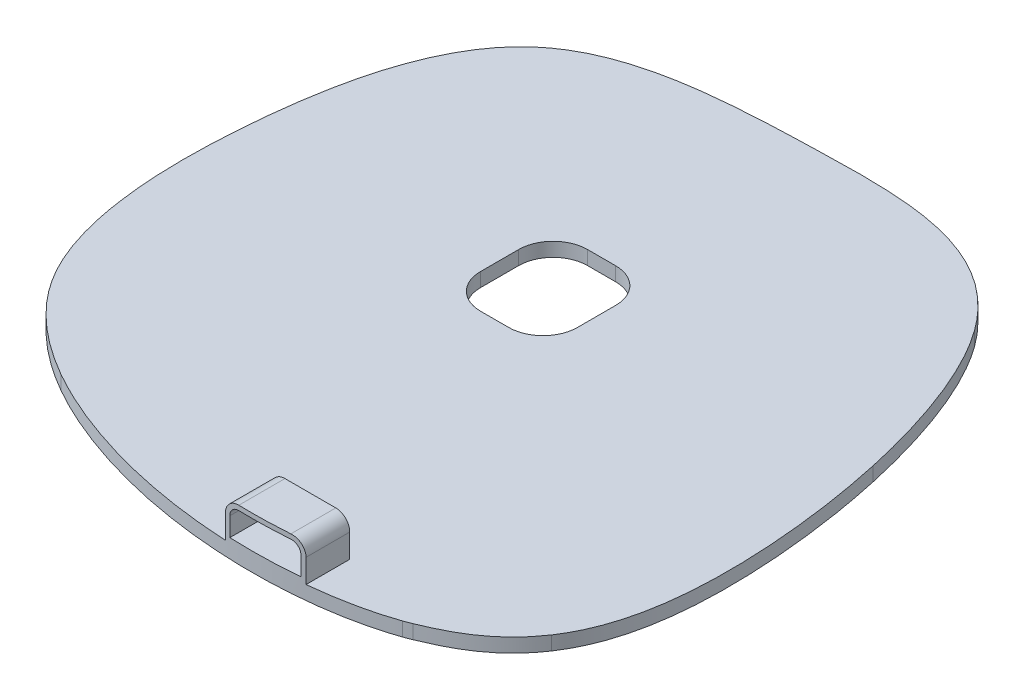
from build123d import *
from OCP.BRepAlgoAPI import BRepAlgoAPI_Cut
from OCP.TopTools import TopTools_ListOfShape

# Parameters (mm, degrees)
BOSS_EXTRUDE1_DEPTH     = 3
CUT_EXTRUDE1_DEPTH      = 144.23767893
CUT_EXTRUDE1_DEPTH_BACK = 144.23767893
BOSS_EXTRUDE3_START     = 10
BOSS_EXTRUDE3_DEPTH     = 9.956318054
BOSS_EXTRUDE3_START_2   = -8.187017634
BOSS_EXTRUDE3_2_DEPTH   = 9.187017634


with BuildPart() as part:
    # Sketch3 → Boss-Extrude1 (new body)
    with BuildSketch(Plane.XZ.offset(8.187017634)):
        with BuildLine():
            add(Edge.make_bspline(
                [(-43.682566816, -9.809144312), (-43.590850956, -9.669201086), (-43.396610236, -9.372821886), (-43.080896899, -8.908734706), (-42.724393103, -8.400321885), (-42.32400403, -7.849195802), (-41.615293388, -6.908817047), (-40.808804908, -5.913212767), (-39.421316231, -4.319477259), (-37.76057815, -2.587225531), (-35.792161476, -0.778420463), (-34.111819694, 0.631689986), (-32.693848258, 1.745924093), (-31.251435295, 2.810065063), (-29.788918148, 3.825847458), (-28.309782938, 4.793892733), (-26.819630528, 5.718932105), (-25.812202881, 6.30280495), (-25.310659617, 6.593483385)],
                knots=[0, 0, 0, 0, 0.020191439, 0.042762503, 0.067732139, 0.095123596, 0.124964849, 0.209829091, 0.249662232, 0.379957752, 0.499149862, 0.572092554, 0.644633713, 0.716739963, 0.788372792, 0.859490184, 0.930047828, 1, 1, 1, 1], degree=3))
            add(Edge.make_bspline(
                [(-25.310659617, 6.593483385), (-24.970200363, 6.785793855), (-24.280182246, 7.175554764), (-23.220093945, 7.747533568), (-22.12405835, 8.319167417), (-20.990827613, 8.888158763), (-19.820305217, 9.454140313), (-18.189743738, 10.212695389), (-16.502634346, 10.951826298), (-13.577439707, 12.158400035), (-9.444540771, 13.700220079), (-3.555445749, 15.541221152), (2.278739642, 17.006312941), (8.004123853, 18.146930639), (13.402502776, 18.977806488), (20.675142188, 19.749806445), (29.639972518, 20.117081214), (38.263934767, 19.682989741), (44.798325753, 18.85040122), (48.403246041, 18.209053366), (50.781276858, 17.683644778), (52.16838647, 17.346896245), (53.438020845, 17.018093105), (54.878425382, 16.608660829), (56.244093222, 16.182108454), (57.030439158, 15.911224408), (57.366403469, 15.795489885)],
                knots=[0, 0, 0, 0, 0.013751042, 0.027869615, 0.042359051, 0.057222443, 0.072462572, 0.088081834, 0.120464948, 0.137230934, 0.199359689, 0.275519761, 0.354105918, 0.410781923, 0.480777502, 0.546109171, 0.667907428, 0.79592754, 0.84921164, 0.899494417, 0.92463146, 0.93484759, 0.949692056, 0.970752009, 0.98750387, 1, 1, 1, 1], degree=3))
            add(Edge.make_bspline(
                [(57.366403469, 15.795489885), (57.919521789, 15.601207307), (58.449218921, 15.397557399), (58.991043235, 15.172433481)],
                knots=[-0.176019581, -0.176019581, -0.176019581, -0.176019581, 0, 0, 0, 0], degree=3, weights=[1, 1, 1, 1]))
            add(Edge.make_bspline(
                [(58.991043235, 15.172433481), (59.634186233, 14.900681635), (60.900085641, 14.365792036), (62.725726454, 13.520013652), (64.458799852, 12.645249568), (66.810958903, 11.307685619), (69.534038895, 9.44170771), (72.297914712, 6.965561641), (74.392789476, 4.635992549), (75.489070594, 3.080204878), (75.985982473, 2.375012239)],
                knots=[0, 0, 0, 0, 0.096909833, 0.190747782, 0.27923455, 0.366292326, 0.566253189, 0.735974001, 0.880324806, 1, 1, 1, 1], degree=3))
            add(Edge.make_bspline(
                [(75.985982473, 2.375012239), (76.088015858, 2.220624418), (76.294048091, 1.908874812), (76.595298016, 1.429668488), (76.894212142, 0.936012093), (77.189730191, 0.426951878), (77.58321526, -0.28003934), (78.065377712, -1.205741604), (78.620675828, -2.374033471), (79.156084112, -3.614870737), (79.669149921, -4.932396369), (80.071056325, -6.083754953), (80.46119802, -7.301576492), (80.758320385, -8.31998231), (81.036788019, -9.371049159), (81.240017196, -10.192874343), (81.434715144, -11.039190011), (81.878857858, -13.122405334), (82.404381966, -16.338232988), (82.82455413, -20.51848832), (83.025188464, -24.19433304), (83.092428842, -27.302921809), (83.086797443, -30.027635006), (83.030841686, -32.595470269), (82.926060916, -35.1954941), (82.77429239, -37.818991711), (82.577350997, -40.457703759), (82.337016037, -43.103819594), (82.055037768, -45.749965785), (81.733129079, -48.38919365), (81.372996817, -51.014974842), (80.976230154, -53.621165553), (80.544717041, -56.202087277), (80.079111937, -58.752177434), (79.584473973, -61.267223057), (79.225342853, -62.927362848), (79.04695737, -63.751977655)],
                knots=[0, 0, 0, 0, 0.008202511, 0.016563026, 0.025087347, 0.033781584, 0.042652161, 0.060949615, 0.080037457, 0.099978579, 0.120841024, 0.142697979, 0.154023665, 0.177520757, 0.189713624, 0.20221753, 0.215043977, 0.228204775, 0.296629414, 0.359325815, 0.414352076, 0.459761624, 0.497130193, 0.535117705, 0.573601518, 0.61246416, 0.651593538, 0.690883057, 0.730231678, 0.769543936, 0.808729915, 0.847705209, 0.886390848, 0.924713224, 0.962603998, 1, 1, 1, 1], degree=3))
            add(Edge.make_bspline(
                [(79.04695737, -63.751977655), (78.951356262, -64.18016083), (78.76069578, -65.034100832), (78.46273267, -66.308282168), (78.157125506, -67.572429364), (77.843107847, -68.825759318), (77.521060237, -70.067757704), (77.082800559, -71.701393), (76.627476175, -73.31633203), (76.039280361, -75.301311065), (75.554141141, -76.86146511), (75.051994106, -78.399614249), (74.670239624, -79.532229636), (74.28163008, -80.649060636), (73.886297687, -81.749685133), (73.484373815, -82.833694777), (73.075988984, -83.90069485), (72.661272846, -84.950304117), (72.240354178, -85.982154696), (71.813360869, -86.995891912), (71.380419903, -87.991174161), (70.941657358, -88.967672769), (70.497198382, -89.925071851), (70.047167197, -90.86306818), (69.591687064, -91.781371028), (69.130880342, -92.679702077), (68.664868233, -93.557795105), (68.193771658, -94.415396488), (67.717708014, -95.25226271), (67.236802953, -96.068168778), (66.751147438, -96.862876947), (66.260953983, -97.63624986), (65.765988259, -98.387838319), (65.267635916, -99.118379651), (64.927127521, -99.593225407), (64.758385477, -99.828539558)],
                knots=[0, 0, 0, 0, 0.033703637, 0.067216289, 0.100524355, 0.133614665, 0.166474475, 0.199091472, 0.263549931, 0.295368927, 0.358133543, 0.389059312, 0.419668221, 0.44995145, 0.479900623, 0.509507815, 0.538765558, 0.567666836, 0.596205102, 0.624374272, 0.652168737, 0.679583368, 0.706613524, 0.733255056, 0.759504318, 0.785358176, 0.810814018, 0.835869763, 0.860523874, 0.88477537, 0.908623841, 0.932069458, 0.955112993, 0.977755834, 1, 1, 1, 1], degree=3))
            add(Edge.make_bspline(
                [(64.758385477, -99.828539558), (64.620833669, -100.016368182), (64.344788823, -100.39331069), (63.918099149, -100.952254036), (63.480138881, -101.508325371), (63.029928035, -102.060420971), (62.411486968, -102.793000167), (61.769957307, -103.513450765), (60.936254034, -104.399463363), (60.243283196, -105.095419989), (59.344042766, -105.947188435), (58.597668051, -106.612864903), (57.826463104, -107.259163358), (57.232387659, -107.736250088), (56.624302097, -108.203763256), (56.002068014, -108.661291678), (55.365550198, -109.108437816), (54.673052488, -109.572687777), (53.912329242, -110.056556914), (53.070542905, -110.560901026), (52.178866157, -111.062124601), (51.23624193, -111.55714185), (50.241624161, -112.042904214), (49.193985217, -112.516416626), (48.092328575, -112.974784934), (46.935676914, -113.415155894), (45.723158975, -113.83508307), (44.453707222, -114.231220178), (43.127288624, -114.604606054), (42.218805468, -114.82426226), (41.756564939, -114.936024377)],
                knots=[0, 0, 0, 0, 0.024802332, 0.04977438, 0.074911543, 0.100209959, 0.125666532, 0.177045783, 0.202966362, 0.255270656, 0.281657521, 0.334915328, 0.361794842, 0.388848642, 0.416083239, 0.443506004, 0.471125138, 0.498949639, 0.532320834, 0.567164667, 0.603482709, 0.641282725, 0.680578858, 0.721391653, 0.763747911, 0.807680357, 0.853227126, 0.900431062, 0.949338853, 1, 1, 1, 1], degree=3))
            add(Edge.make_bspline(
                [(41.756564939, -114.936024377), (41.533266459, -114.987160005), (41.08631501, -115.089512438), (40.412801965, -115.231793831), (39.736503153, -115.366275128), (39.057298507, -115.492344902), (38.147057224, -115.649980715), (37.232260936, -115.791835822), (36.313360611, -115.918900879), (35.620958356, -116.007186166), (34.129680783, -116.181837161), (31.5986018, -116.410377634), (26.828764887, -116.648833416), (20.892195037, -116.65402114), (16.232067673, -116.521853235), (14.038080795, -116.459628616)],
                knots=[0, 0, 0, 0, 0.024685861, 0.049410912, 0.074178424, 0.098991326, 0.123852205, 0.173726634, 0.198743773, 0.223816093, 0.24894466, 0.360545024, 0.497599841, 0.763470122, 1, 1, 1, 1], degree=3))
            add(Edge.make_bspline(
                [(14.038080795, -116.459628616), (13.112074766, -116.432452497), (11.104409244, -116.373532194), (7.863958462, -116.265735768), (4.17306462, -116.115013671), (0.540617107, -115.918987543), (-2.777851751, -115.682646122), (-5.537397715, -115.43740014), (-7.990606591, -115.173338192), (-10.143924222, -114.898532196), (-12.006080107, -114.627226067), (-13.148705413, -114.433250154), (-13.673818168, -114.344105247)],
                knots=[0, 0, 0, 0, 0.099911626, 0.216617516, 0.349670282, 0.498296176, 0.608923162, 0.708453247, 0.797066976, 0.875009306, 0.942558416, 1, 1, 1, 1], degree=3))
            add(Edge.make_bspline(
                [(-13.673818168, -114.344105247), (-13.970739404, -114.291089151), (-14.571132266, -114.183887371), (-15.479001454, -114.008575392), (-16.403801601, -113.819117087), (-17.344384377, -113.613457118), (-18.299734879, -113.390604385), (-19.26871308, -113.14916991), (-20.250121223, -112.88776543), (-21.242681235, -112.604888384), (-22.245036662, -112.298947918), (-23.255748503, -111.96825321), (-24.273289849, -111.611006969), (-25.654325943, -111.09020844), (-27.822346226, -110.17832354), (-30.016698648, -109.056631746), (-31.844599549, -107.940949025), (-32.926803947, -107.216397507), (-33.886354797, -106.515178374), (-34.733295775, -105.848882578), (-35.249686706, -105.404078817), (-35.494141669, -105.193512596)],
                knots=[0, 0, 0, 0, 0.037767018, 0.076367217, 0.115776309, 0.155969589, 0.196922141, 0.238609104, 0.281005988, 0.324089052, 0.367835753, 0.412225276, 0.457239152, 0.502861971, 0.597023372, 0.751642776, 0.810819094, 0.865109834, 0.914666842, 0.959604027, 1, 1, 1, 1], degree=3))
            add(Edge.make_bspline(
                [(-35.494141669, -105.193512596), (-35.626741826, -105.075696752), (-35.899851365, -104.833037683), (-36.312321285, -104.448369639), (-36.740590608, -104.033866303), (-37.182815468, -103.587434367), (-37.637982925, -103.107940315), (-38.104792819, -102.593937879), (-38.581984955, -102.044051019), (-39.0682583, -101.456849581), (-40.163982538, -100.0686547), (-41.443666492, -98.205043824), (-42.778519673, -95.911703295), (-43.719327717, -94.101622502), (-44.529073748, -92.377319671), (-45.243573127, -90.704688712), (-45.873261693, -89.095049391), (-46.426425424, -87.557885985), (-46.913806433, -86.102392627), (-47.203760422, -85.156001065), (-47.343722969, -84.699172126)],
                knots=[0, 0, 0, 0, 0.022190276, 0.045704138, 0.070552716, 0.096749655, 0.124311255, 0.153256569, 0.183607452, 0.215388574, 0.248627377, 0.404848734, 0.497602647, 0.580491675, 0.659972034, 0.73586822, 0.807996188, 0.876173915, 0.940228399, 1, 1, 1, 1], degree=3))
            add(Edge.make_bspline(
                [(-47.343722969, -84.699172126), (-47.426605213, -84.41990961), (-47.59285805, -83.859739142), (-47.831019446, -83.013589645), (-48.062098664, -82.160304946), (-48.285333941, -81.299907364), (-48.501086883, -80.432757833), (-48.77952553, -79.265124665), (-49.109120718, -77.790547015), (-49.475557562, -76.00292751), (-49.814848312, -74.195367937), (-50.075392766, -72.676750781), (-50.39751987, -70.666586541), (-50.762317365, -68.125649136), (-51.110511089, -65.228796972), (-51.373406999, -62.6801146), (-51.579517995, -60.432712987), (-51.699426024, -58.841307806), (-51.762759277, -58.000756358)],
                knots=[0, 0, 0, 0, 0.032229856, 0.064649613, 0.09725417, 0.130038089, 0.162995605, 0.196120636, 0.262847391, 0.330163733, 0.398010553, 0.466324485, 0.500635701, 0.62325484, 0.750310245, 0.823427609, 0.906737655, 1, 1, 1, 1], degree=3))
            add(Edge.make_bspline(
                [(-51.762759277, -58.000756358), (-51.795033267, -57.537361259), (-51.860853701, -56.592300942), (-51.947815455, -55.146743298), (-52.075275332, -52.706895132), (-52.192026201, -49.310542181), (-52.20474908, -45.701864869), (-52.140041087, -42.87438884), (-52.056673722, -40.836546175), (-51.941504829, -38.892643462), (-51.797928621, -37.041461154), (-51.628373209, -35.281833859), (-51.439073959, -33.611980703), (-51.291509782, -32.530616736), (-51.219658482, -32.004083748)],
                knots=[0, 0, 0, 0, 0.053492555, 0.109094143, 0.16676522, 0.334841555, 0.500384684, 0.582252162, 0.660516776, 0.73524084, 0.806487943, 0.874321793, 0.93880532, 1, 1, 1, 1], degree=3))
            add(Edge.make_bspline(
                [(-51.219658482, -32.004083748), (-51.177715838, -31.714223997), (-51.095740019, -31.147700573), (-50.965093523, -30.319152924), (-50.833341627, -29.53091103), (-50.700610923, -28.782612757), (-50.5283868, -27.862600866), (-50.353729713, -26.995016538), (-49.997846268, -25.342300965), (-49.482664818, -23.224931249), (-48.642961522, -20.37712469), (-47.681953975, -17.650061603), (-46.776633052, -15.50314226), (-46.038749171, -13.953494025), (-45.521747009, -12.936992921), (-44.958540623, -11.904094479), (-44.348203643, -10.854566939), (-43.906773278, -10.161274031), (-43.682566816, -9.809144312)],
                knots=[0, 0, 0, 0, 0.03719078, 0.072688422, 0.106510152, 0.138672754, 0.169192482, 0.225365207, 0.251047394, 0.383872919, 0.501961568, 0.627932921, 0.750844996, 0.797616395, 0.845866745, 0.895640654, 0.946994947, 1, 1, 1, 1], degree=3))
        make_face()
    extrude(amount=BOSS_EXTRUDE1_DEPTH)

    # Sketch4 → Cut-Extrude1 (cut, two sides: drawn at the far end of the back side and taken through both)
    with BuildSketch(Plane(origin=(0, -8.187017634, 0), x_dir=(1, 0, 0), z_dir=(0, 1, 0)).offset(-CUT_EXTRUDE1_DEPTH_BACK)):
        with BuildLine():
            Line((14.097017634, 50.29), (8.057017634, 50.29))
            ThreePointArc((8.057017634, 50.29), (2.824427454, 52.457409819), (0.657017634, 57.69))
            Line((0.657017634, 57.69), (0.657017634, 65.89))
            ThreePointArc((0.657017634, 65.89), (2.824427454, 71.122590181), (8.057017634, 73.29))
            Line((8.057017634, 73.29), (14.097017634, 73.29))
            ThreePointArc((14.097017634, 73.29), (19.329607815, 71.122590181), (21.497017634, 65.89))
            Line((21.497017634, 65.89), (21.497017634, 57.69))
            ThreePointArc((21.497017634, 57.69), (19.329607815, 52.457409819), (14.097017634, 50.29))
        make_face()
    extrude(amount=CUT_EXTRUDE1_DEPTH + CUT_EXTRUDE1_DEPTH_BACK, mode=Mode.SUBTRACT)


with BuildPart() as boss_extrude3_tool:
    # Boss-Extrude3: read off the stored shape, not the designer's step
    # Boss-Extrude3 outline → Boss-Extrude3 (new body)
    with BuildSketch(Plane.XY.offset(BOSS_EXTRUDE3_START)):
        with BuildLine():
            ThreePointArc((26.264565024, -0.11), (24.143244681, -0.988679656), (23.264565024, -3.11))
            Line((23.264565024, -3.11), (23.264565024, -8.187017634))
            Line((23.264565024, -8.187017634), (40.2, -8.187017634))
            Line((40.2, -8.187017634), (40.2, -3.11))
            ThreePointArc((40.2, -3.11), (39.321320344, -0.988679656), (37.2, -0.11))
            Line((37.2, -0.11), (26.264565024, -0.11))
        make_face()
        with BuildLine():
            Line((24.264565024, -7.187017634), (24.264565024, -3.11))
            ThreePointArc((24.264565024, -3.11), (24.850351462, -1.695786438), (26.264565024, -1.11))
            Line((26.264565024, -1.11), (37.2, -1.11))
            ThreePointArc((37.2, -1.11), (38.614213562, -1.695786438), (39.2, -3.11))
            Line((39.2, -3.11), (39.2, -7.187017634))
            Line((39.2, -7.187017634), (24.264565024, -7.187017634))
        make_face(mode=Mode.SUBTRACT)
    extrude(amount=BOSS_EXTRUDE3_DEPTH)


with BuildPart() as part_1:
    add(part.part)


with BuildPart() as part_2:
    # Boss-Extrude3: joined with boss_extrude3_tool
    add(part_1.part.fuse(boss_extrude3_tool.part, tol=0.00001))


with BuildPart() as boss_extrude3_2_tool:
    # Boss-Extrude3 2 outline → Boss-Extrude3 2 (new body)
    with BuildSketch(Plane(origin=(0, 0, 0), x_dir=(1, 0, 0), z_dir=(0, 1, 0)).offset(BOSS_EXTRUDE3_START_2)):
        with BuildLine():
            Line((24.264565024, -19.956318054), (24.264565024, -19.859308482))
            add(Edge.make_bspline(
                [(24.264565024, -19.859308482), (23.931167735, -19.845836529), (23.597831656, -19.830973707), (23.264567928, -19.814727716)],
                knots=[0.393027076, 0.393027076, 0.393027076, 0.393027076, 0.404757906, 0.404757906, 0.404757906, 0.404757906], degree=3))
            Line((23.264567928, -19.814727716), (23.264565024, -19.956318054))
            Line((23.264565024, -19.956318054), (24.264565024, -19.956318054))
        make_face()
        with BuildLine():
            add(Edge.make_bspline(
                [(39.2, -19.495910802), (35.964454666, -19.796764644), (32.575352878, -19.950307169), (29.186595848, -19.956317953), (29.048223115, -19.956317954)],
                knots=[0.21783988, 0.21783988, 0.21783988, 0.21783988, 0.332092572, 0.336956496, 0.336956496, 0.336956496, 0.336956496], degree=3))
            Line((29.048223115, -19.956317954), (39.2, -19.956318054))
            Line((39.2, -19.956318054), (39.2, -19.495910802))
        make_face()
        with BuildLine():
            add(Edge.make_bspline(
                [(29.048223115, -19.956317954), (27.453082997, -19.956317962), (25.858124798, -19.923701211), (24.264565024, -19.859308482)],
                knots=[0.336956496, 0.336956496, 0.336956496, 0.336956496, 0.393027076, 0.393027076, 0.393027076, 0.393027076], degree=3))
            Line((24.264565024, -19.859308482), (24.264565024, -19.956318054))
            Line((24.264565024, -19.956318054), (29.048223115, -19.956317954))
        make_face()
        with BuildLine():
            add(Edge.make_bspline(
                [(40.2, -19.397965722), (39.866839123, -19.432258793), (39.533500137, -19.464900637), (39.2, -19.495910802)],
                knots=[0.206063415, 0.206063415, 0.206063415, 0.206063415, 0.21783988, 0.21783988, 0.21783988, 0.21783988], degree=3))
            Line((39.2, -19.495910802), (39.2, -19.956318054))
            Line((39.2, -19.956318054), (40.2, -19.956318054))
            Line((40.2, -19.956318054), (40.2, -19.397965722))
        make_face()
    extrude(amount=BOSS_EXTRUDE3_2_DEPTH)


with BuildPart() as part_3:
    add(part_2.part)

    # Boss-Extrude3 2: cut by boss_extrude3_2_tool, with a tolerance
    boss_extrude3_2_stock = TopTools_ListOfShape()
    boss_extrude3_2_stock.Append(part_3.part.wrapped)
    boss_extrude3_2_tools = TopTools_ListOfShape()
    boss_extrude3_2_tools.Append(boss_extrude3_2_tool.part.wrapped)
    boss_extrude3_2_cut = BRepAlgoAPI_Cut()
    boss_extrude3_2_cut.SetArguments(boss_extrude3_2_stock)
    boss_extrude3_2_cut.SetTools(boss_extrude3_2_tools)
    boss_extrude3_2_cut.SetFuzzyValue(0.00001)
    boss_extrude3_2_cut.Build()
    add(Compound.cast(boss_extrude3_2_cut.Shape()).solids(), mode=Mode.REPLACE)


solid = part_3.part
